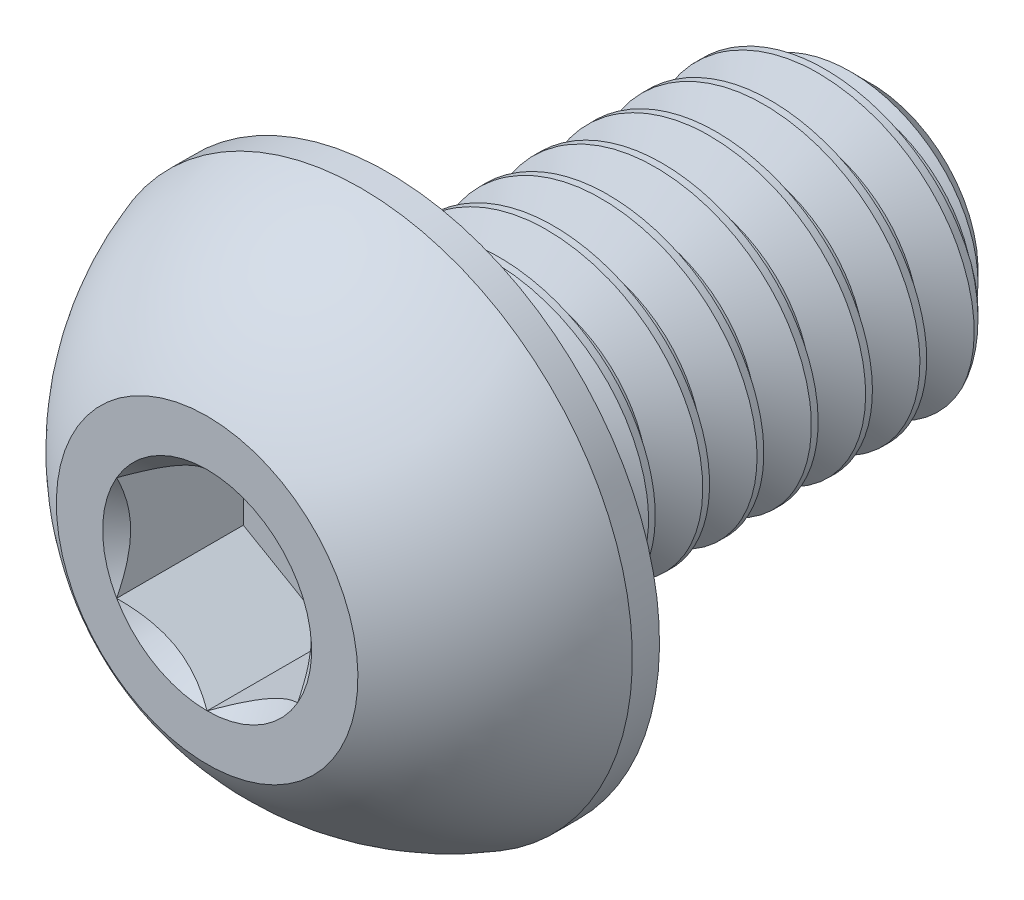
from build123d import *

# Parameters (mm, degrees)
CUT_EXTRUDE1_DEPTH = 1.05
CUT_SWEEP1_PITCH   = 0.45
CUT_SWEEP1_TO      = 4


with BuildPart() as part:
    # Sketch2 → Revolve1 (revolve)
    with BuildSketch(Plane(origin=(0, 0, 0), x_dir=(0, 0, -1), z_dir=(1, 0, 0)), mode=Mode.PRIVATE) as revolve1_sk:
        with BuildLine():
            Line((-2.75, 0), (2.75, 0))
            Line((2.75, 0), (2.75, 0.89))
            Line((2.75, 0.89), (2.39, 1.25))
            Line((2.39, 1.25), (-1.25, 1.25))
            Line((-1.25, 1.25), (-1.25, 2.25))
            Line((-1.25, 2.25), (-1.475, 2.25))
            ThreePointArc((-1.475, 2.25), (-2.200735294, 1.8625), (-2.75, 1.25))
            Line((-2.75, 1.25), (-2.75, 0))
        make_face()
    revolve(revolve1_sk.sketch.rotate(Axis((0, 0, 2.75), (0, 0, -1)), 180), axis=Axis((0, 0, 2.75), (0, 0, -1)))

    # Sketch3 → Cut-Extrude1 (cut)
    with BuildSketch(Plane.XY.offset(2.75)):
        Polygon((0, 0.866025404), (-0.75, 0.433012702), (-0.75, -0.433012702), (0, -0.866025404), (0.75, -0.433012702), (0.75, 0.433012702), align=None)
    extrude(amount=-CUT_EXTRUDE1_DEPTH, mode=Mode.SUBTRACT)

    # Cut-Extrude2 cone 1 section (through the dimple's axis) → Cut-Extrude2 (revolve, cut)
    with BuildSketch(Plane(origin=(0, 0, 2.75), x_dir=(0, -1, 0), z_dir=(1, 0, 0))):
        Polygon((0, 0), (0.866025404, 0), (0, 0.866025404), align=None)
    revolve(axis=Axis((0, 0, 2.75), (0, 0, -1)), mode=Mode.SUBTRACT)


with BuildPart() as body_2:
    # Split1: read off the stored shape, not the designer's step
    # Split1: the piece on the far side of the plane
    add(part.part)
    split(bisect_by=Plane.XY.offset(1.25), keep=Keep.BOTTOM)

    # Cut-Sweep1: arcs per turn and ends read off the stored shape
    # Cut-Sweep1: the profile of Sketch6 screwed along a right-hand helix through 9.888889 turns, 6 arcs to a turn; built about Z, then put on its axis
    cut_sweep1_z = Axis((0, 0, 0), (0, 0, 1))
    cut_sweep1_corners = [(0.957716426, 0, -0.16875), (0.957716426, 0, -0.225), (1.274356964, 0, -0.4078125), (1.274356964, 0, 0.0140625)]
    with BuildLine(mode=Mode.PRIVATE) as cut_sweep1_profile:
        Line(cut_sweep1_corners[0], cut_sweep1_corners[1])
        Line(cut_sweep1_corners[1], cut_sweep1_corners[2])
        Line(cut_sweep1_corners[2], cut_sweep1_corners[3])
        Line(cut_sweep1_corners[3], cut_sweep1_corners[0])
    cut_sweep1_cap = Face(cut_sweep1_profile.wire())
    cut_sweep1_turn_angles = [0, 30, 60, 90, 120, 150, 180, 210, 240, 270, 300, 330, 360]
    cut_sweep1_turn_weights = [1, 0.8660254037844387, 1, 0.8660254037844387, 1, 0.8660254037844387, 1, 0.8660254037844387, 1, 0.8660254037844387, 1, 0.8660254037844387, 1]
    cut_sweep1_turn_rails = [Edge.make_bspline([Vector(p[0], p[1], 0).rotate(cut_sweep1_z, cut_sweep1_turn_angles[k]) / cut_sweep1_turn_weights[k] + Vector(0, 0, p[2] + CUT_SWEEP1_PITCH * cut_sweep1_turn_angles[k] / 360) for k in range(13)], [0, 0, 0, 1, 1, 2, 2, 3, 3, 4, 4, 5, 5, 6, 6, 6], 2, cut_sweep1_turn_weights) for p in cut_sweep1_corners]
    cut_sweep1_turn_sides = [Face.make_surface_from_curves(cut_sweep1_turn_rails[p[0]], cut_sweep1_turn_rails[p[1]]) for p in [(0, 1), (1, 2), (2, 3), (3, 0)]]
    cut_sweep1_last_angles = [3240, 3270, 3300, 3330, 3360, 3390, 3420, 3450, 3480, 3510, 3540, 3550, 3560]
    cut_sweep1_last_weights = [1, 0.8660254037844387, 1, 0.8660254037844387, 1, 0.8660254037844387, 1, 0.8660254037844387, 1, 0.8660254037844387, 1, 0.9848077530122157, 1]
    cut_sweep1_last_rails = [Edge.make_bspline([Vector(p[0], p[1], 0).rotate(cut_sweep1_z, cut_sweep1_last_angles[k]) / cut_sweep1_last_weights[k] + Vector(0, 0, p[2] + CUT_SWEEP1_PITCH * cut_sweep1_last_angles[k] / 360) for k in range(13)], [0, 0, 0, 1, 1, 2, 2, 3, 3, 4, 4, 5, 5, 6, 6, 6], 2, cut_sweep1_last_weights) for p in cut_sweep1_corners]
    cut_sweep1_last_sides = [Face.make_surface_from_curves(cut_sweep1_last_rails[p[0]], cut_sweep1_last_rails[p[1]]) for p in [(0, 1), (1, 2), (2, 3), (3, 0)]]
    cut_sweep1 = Plane(origin=(0, 0, -2.75), x_dir=(0, 1, 0), z_dir=(0, 0, 1)) * split(Solid(Shell([*[p.moved(Location((0, 0, CUT_SWEEP1_PITCH * i))) for i in range(9) for p in cut_sweep1_turn_sides], *cut_sweep1_last_sides, cut_sweep1_cap, cut_sweep1_cap.rotate(cut_sweep1_z, 3560).moved(Location((0, 0, CUT_SWEEP1_PITCH * 3560 / 360)))])), bisect_by=Plane.XY.offset(CUT_SWEEP1_TO), keep=Keep.BOTTOM, mode=Mode.PRIVATE)
    add(cut_sweep1, mode=Mode.SUBTRACT)


with BuildPart() as part_1:
    add(part.part)

    # Split1
    split(bisect_by=Plane.XY.offset(1.25), keep=Keep.TOP)

    add(body_2.part)  # Boss-Extrude1 merges body 2
    # Boss-Extrude1: read off the stored shape, not the designer's step
    # Boss-Extrude1 outline → Boss-Extrude1 (revolve)
    with BuildSketch(Plane.XZ):
        Polygon((0.957715049, 1.25), (0.957715049, 0.743747615), (1.25, 1.25), align=None)
    revolve(axis=Axis((0, 0, 0), (0, 0, 1)))


solid = part_1.part
